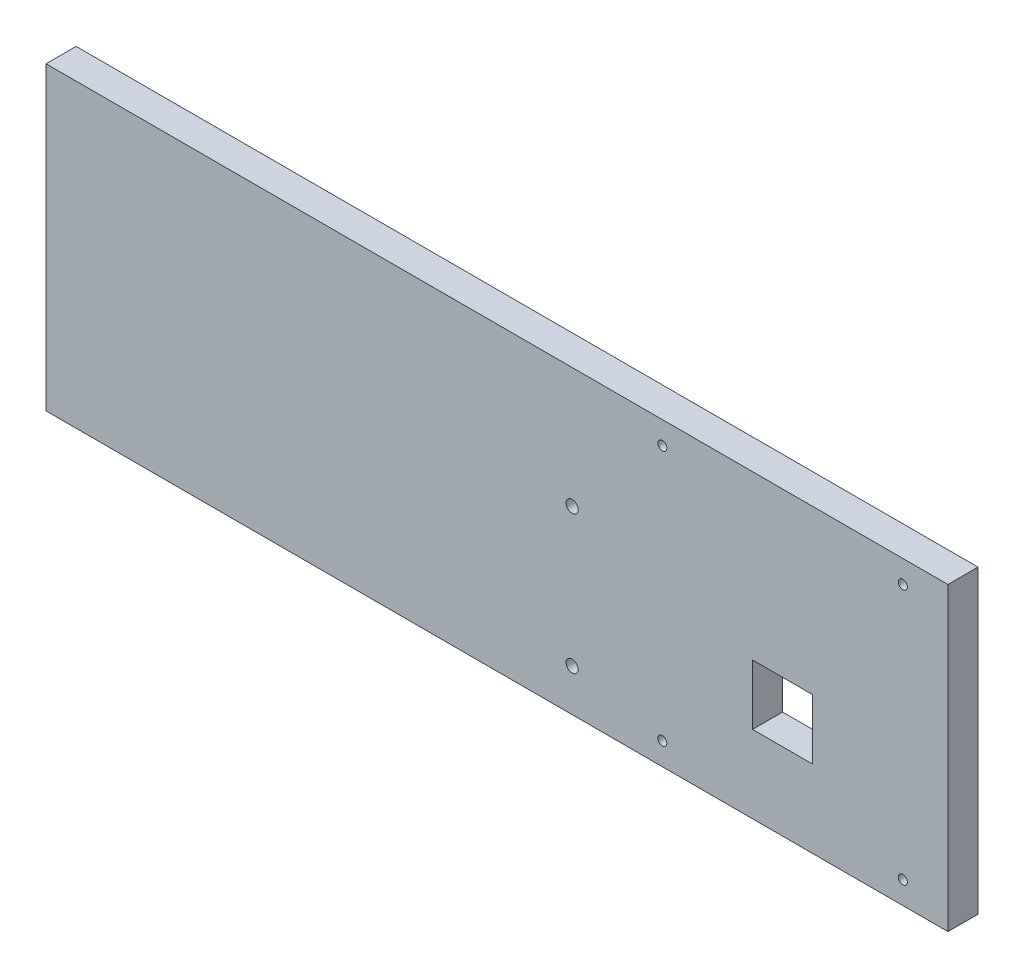
from build123d import *

# Parameters (mm, degrees)
ESBO_O1_W                = 300
ESBO_O1_H                = 100
ESBO_O1_R                = 1.5
ESBO_O1_R_2              = 2
ESBO_O1_W_2              = 20
ESBO_O1_H_2              = 20
RESSALTO_EXTRUS_O1_DEPTH = 10


with BuildPart() as part:
    # Esboço1 → Ressalto-extrusão1 (new body)
    with BuildSketch(Plane.XY):
        Rectangle(ESBO_O1_W, ESBO_O1_H)
        with Locations((55, -42.5)):
            Circle(ESBO_O1_R, mode=Mode.SUBTRACT)
        with Locations((25, -36)):
            Circle(ESBO_O1_R_2, mode=Mode.SUBTRACT)
        with Locations((135, -42.5)):
            Circle(ESBO_O1_R, mode=Mode.SUBTRACT)
        with Locations((95, -14.25)):
            Rectangle(ESBO_O1_W_2, ESBO_O1_H_2, mode=Mode.SUBTRACT)
        with Locations((25, 10)):
            Circle(ESBO_O1_R_2, mode=Mode.SUBTRACT)
        with Locations((55, 42.5)):
            Circle(ESBO_O1_R, mode=Mode.SUBTRACT)
        with Locations((135, 42.5)):
            Circle(ESBO_O1_R, mode=Mode.SUBTRACT)
    extrude(amount=RESSALTO_EXTRUS_O1_DEPTH)


solid = part.part
